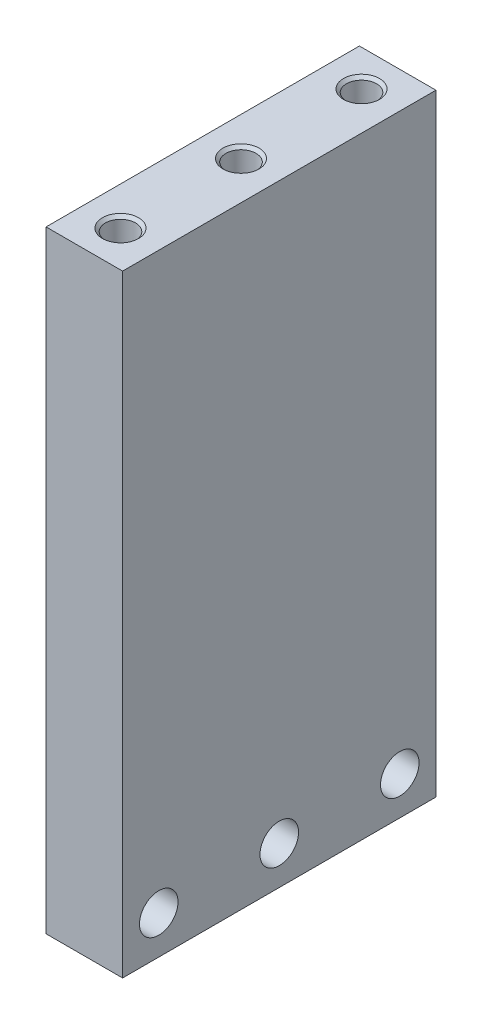
from build123d import *

# Parameters (mm, degrees)
SKETCH1_W           = 6.35
SKETCH1_H           = 50.8
BOSS_EXTRUDE1_DEPTH = 26
SKETCH4_R           = 1.6
CUT_EXTRUDE3_DEPTH  = 6.35
SKETCH14_R          = 1.25
CUT_EXTRUDE13_DEPTH = 5
CHAMFER3_SIZE       = 0.25


with BuildPart() as part:
    # Sketch1 → Boss-Extrude1 (new body)
    with BuildSketch(Plane.XY):
        with Locations((3.175, 25.4)):
            Rectangle(SKETCH1_W, SKETCH1_H)
    extrude(amount=BOSS_EXTRUDE1_DEPTH)

    # Sketch4 → Cut-Extrude3 (cut)
    with BuildSketch(Plane(origin=(6.35, 0, 0), x_dir=(0, 0, -1), z_dir=(1, 0, 0))):
        with Locations((-3, 3.175)):
            Circle(SKETCH4_R)
        with Locations((-23, 3.175)):
            Circle(SKETCH4_R)
        with Locations((-13, 3.175)):
            Circle(SKETCH4_R)
    extrude(amount=-CUT_EXTRUDE3_DEPTH, mode=Mode.SUBTRACT)

    # Sketch14 → Cut-Extrude13 (cut)
    with BuildSketch(Plane(origin=(0, 50.8, 0), x_dir=(1, 0, 0), z_dir=(0, 1, 0))):
        with Locations((3.175, -23)):
            Circle(SKETCH14_R)
        with Locations((3.175, -13)):
            Circle(SKETCH14_R)
        with Locations((3.175, -3)):
            Circle(SKETCH14_R)
    extrude(amount=-CUT_EXTRUDE13_DEPTH, mode=Mode.SUBTRACT)

    # Chamfer3
    chamfer3_edges = [part.edges().sort_by_distance(p)[0] for p in [
        (1.925, 50.8, 23),
        (1.925, 50.8, 13),
        (1.925, 50.8, 3),
    ]]
    chamfer(chamfer3_edges, length=CHAMFER3_SIZE)


solid = part.part
